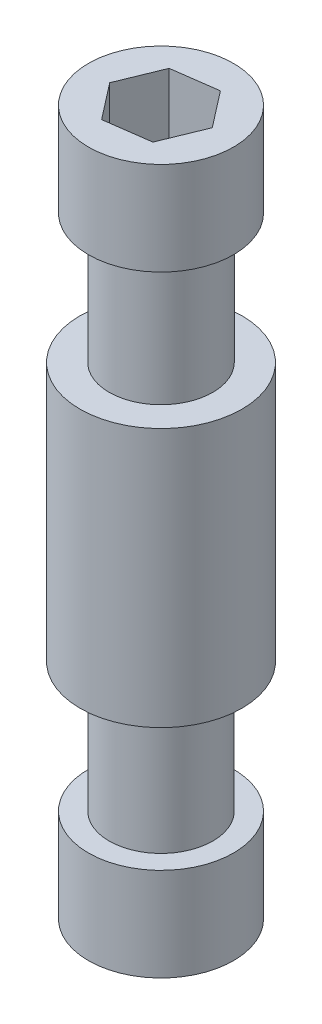
from build123d import *

# Parameters (mm, degrees)
SKETCH1_R           = 3.96875
BOSS_EXTRUDE1_DEPTH = 12.7
SKETCH2_R           = 2.54
BOSS_EXTRUDE2_DEPTH = 6.35
SKETCH3_R           = 3.556
BOSS_EXTRUDE3_DEPTH = 4.572
CUT_EXTRUDE1_DEPTH  = 3.556


with BuildPart() as part:
    # Sketch1 → Boss-Extrude1 (new body)
    with BuildSketch(Plane(origin=(0, 0, 0), x_dir=(1, 0, 0), z_dir=(0, 1, 0))):
        Circle(SKETCH1_R)
    extrude(amount=BOSS_EXTRUDE1_DEPTH)

    # Sketch2 → Boss-Extrude2 (add)
    with BuildSketch(Plane(origin=(0, 12.7, 0), x_dir=(1, 0, 0), z_dir=(0, 1, 0))):
        Circle(SKETCH2_R)
    boss_extrude2 = extrude(amount=BOSS_EXTRUDE2_DEPTH)

    # Sketch3 → Boss-Extrude3 (add)
    with BuildSketch(Plane(origin=(0, 19.05, 0), x_dir=(1, 0, 0), z_dir=(0, 1, 0))):
        Circle(SKETCH3_R)
    boss_extrude3 = extrude(amount=BOSS_EXTRUDE3_DEPTH)

    # Sketch4 → Cut-Extrude1 (cut)
    with BuildSketch(Plane(origin=(0, 23.622, 0), x_dir=(1, 0, 0), z_dir=(0, 1, 0))):
        Polygon((2.212562326, 0.301992807), (0.84474772, 2.067131585), (-1.367814605, 1.765138778), (-2.212562326, -0.301992807), (-0.84474772, -2.067131585), (1.367814605, -1.765138778), align=None)
    cut_extrude1 = extrude(amount=-CUT_EXTRUDE1_DEPTH, mode=Mode.SUBTRACT)

    # Mirror1: Boss-Extrude2, Boss-Extrude3, Cut-Extrude1 across plane
    add(boss_extrude2.mirror(Plane.ZX.offset(6.35)))
    add(boss_extrude3.mirror(Plane.ZX.offset(6.35)))
    add(cut_extrude1.mirror(Plane.ZX.offset(6.35)), mode=Mode.SUBTRACT)


solid = part.part
